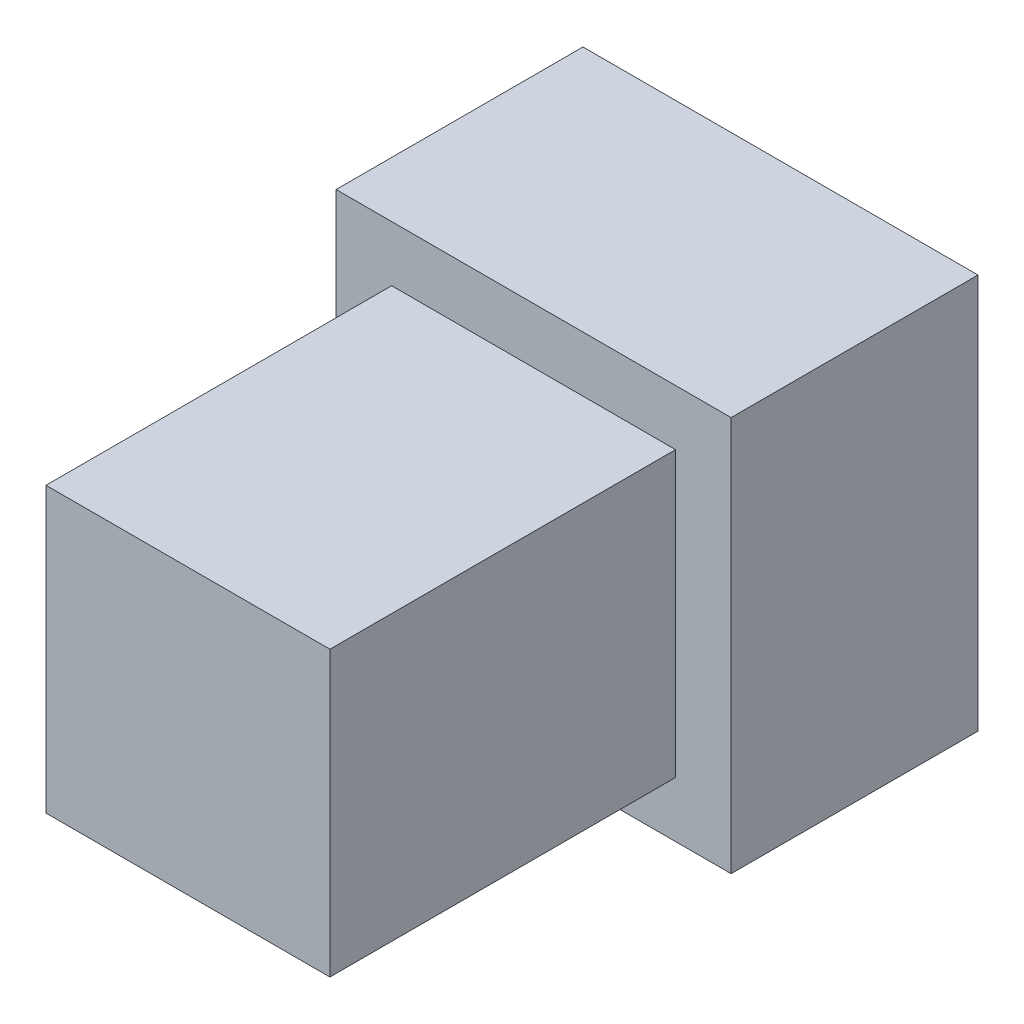
from build123d import *

# Parameters (mm, degrees)
SKETCH1_W           = 8
SKETCH1_H           = 8
BOSS_EXTRUDE1_DEPTH = 5
SKETCH3_W           = 5.75
SKETCH3_H           = 5.75
BOSS_EXTRUDE2_DEPTH = 7


with BuildPart() as part:
    # Sketch1 → Boss-Extrude1 (new body)
    with BuildSketch(Plane.XY):
        Rectangle(SKETCH1_W, SKETCH1_H)
    extrude(amount=BOSS_EXTRUDE1_DEPTH)

    # Sketch3 → Boss-Extrude2 (add)
    with BuildSketch(Plane.XY.offset(5)):
        Rectangle(SKETCH3_W, SKETCH3_H)
    extrude(amount=BOSS_EXTRUDE2_DEPTH)


solid = part.part
